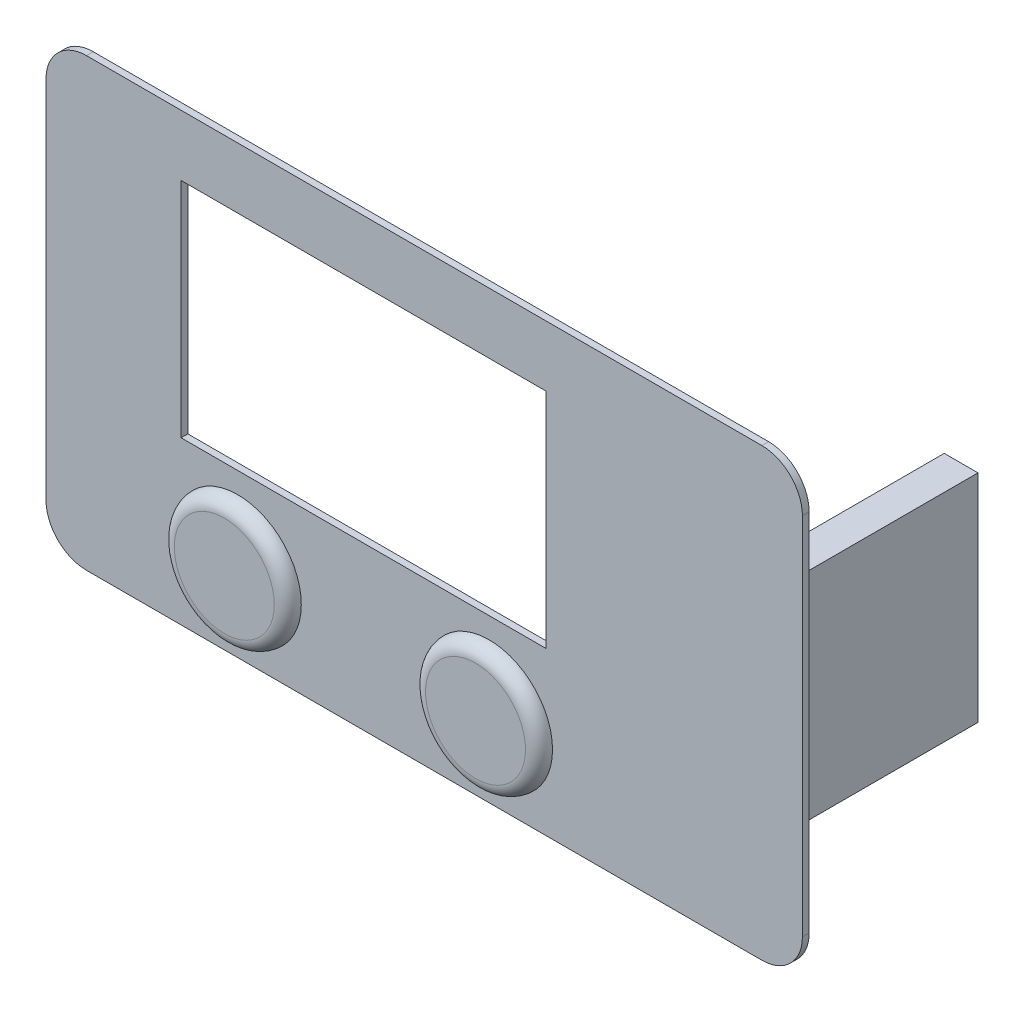
from build123d import *

# Parameters (mm, degrees)
SKETCH1_W           = 56
SKETCH1_H           = 33
BOSS_EXTRUDE1_DEPTH = 0.5
SKETCH2_W           = 27
SKETCH2_H           = 16.5
CUT_EXTRUDE1_DEPTH  = 0.5
SKETCH3_R           = 4.7
BOSS_EXTRUDE2_DEPTH = 1
FILLET1_R           = 1
SKETCH4_W           = 2.5
SKETCH4_H           = 16
BOSS_EXTRUDE3_DEPTH = 15
FILLET2_R           = 3


with BuildPart() as part:
    # Sketch1 → Boss-Extrude1 (new body)
    with BuildSketch(Plane.XY):
        Rectangle(SKETCH1_W, SKETCH1_H)
    extrude(amount=BOSS_EXTRUDE1_DEPTH)

    # Sketch2 → Cut-Extrude1 (cut)
    with BuildSketch(Plane.XY.offset(0.5)):
        with Locations((-4.5, 3.75)):
            Rectangle(SKETCH2_W, SKETCH2_H)
    extrude(amount=-CUT_EXTRUDE1_DEPTH, mode=Mode.SUBTRACT)

    # Sketch3 → Boss-Extrude2 (add)
    with BuildSketch(Plane.XY.offset(0.5)):
        with Locations((-13.8, -10.75)):
            Circle(SKETCH3_R)
        with Locations((4.8, -10.75)):
            Circle(SKETCH3_R)
    extrude(amount=BOSS_EXTRUDE2_DEPTH)

    # Fillet1
    fillet1_edges = [part.edges().sort_by_distance(p)[0] for p in [
        (-18.5, -10.75, 1.5),
        (0.1, -10.75, 1.5),
    ]]
    fillet(fillet1_edges, radius=FILLET1_R - 0.0001)  # a hair under: the kernel refuses the full size

    # Sketch4 → Boss-Extrude3 (add)
    with BuildSketch(Plane(origin=(0, 0, 0), x_dir=(-1, 0, 0), z_dir=(0, 0, -1))):
        with Locations((-24.25, -0.75)):
            Rectangle(SKETCH4_W, SKETCH4_H)
    extrude(amount=BOSS_EXTRUDE3_DEPTH)

    # Fillet2
    fillet2_edges = [part.edges().sort_by_distance(p)[0] for p in [
        (28, -16.5, 0.25),
        (-28, -16.5, 0.25),
        (-28, 16.5, 0.25),
        (28, 16.5, 0.25),
    ]]
    fillet(fillet2_edges, radius=FILLET2_R)


solid = part.part
